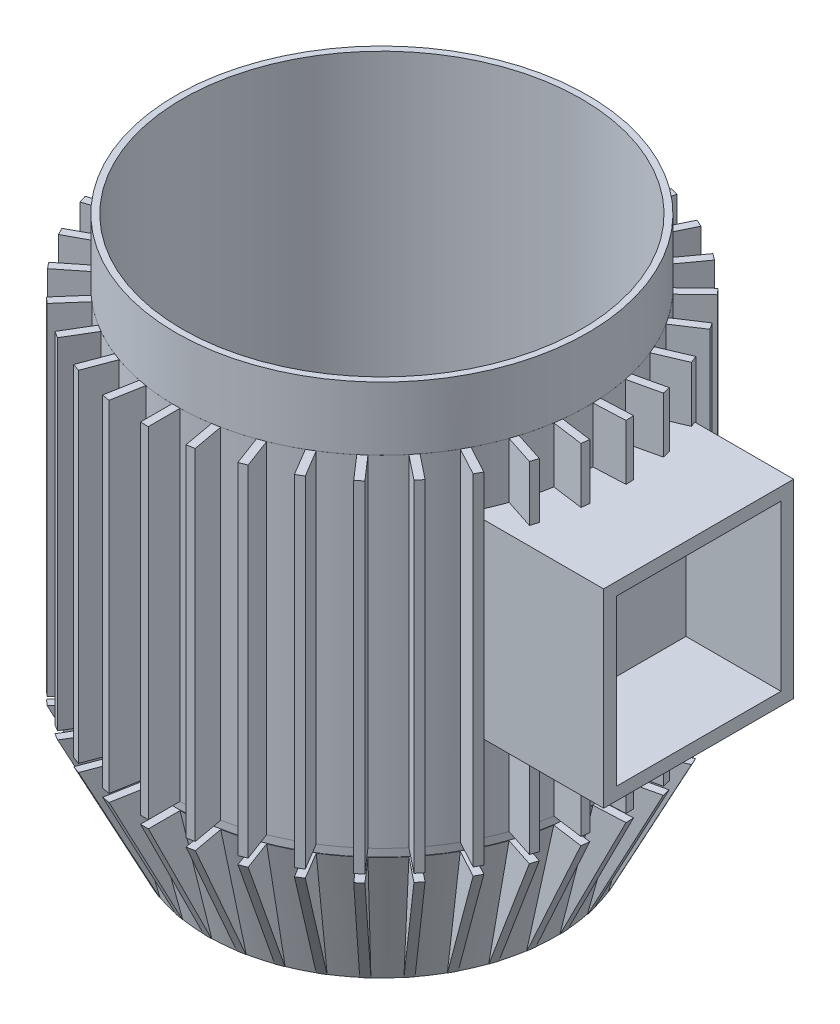
from build123d import *

# Parameters (mm, degrees)
SKETCH1_R           = 1651
BOSS_EXTRUDE1_DEPTH = 4318
CHAMFER1_SIZE       = 254
CHAMFER1_SIZE2      = 1016
SHELL1_T            = -50.8
BOSS_EXTRUDE2_REACH = 5834.329
SKETCH2_W           = 63.5
SKETCH2_H           = 4318
CIRPATTERN1_COUNT   = 35
SKETCH4_R           = 254
CUT_EXTRUDE1_DEPTH  = 5090.331297603
BOSS_EXTRUDE3_REACH = 6484.884
SKETCH6_W           = 1524
SKETCH6_H           = 1524
SKETCH7_W           = 1320.8
SKETCH7_H           = 1320.8
CUT_EXTRUDE3_DEPTH  = 762
SKETCH8_W           = 493.645068523
SKETCH8_H           = 508
SCALE1_SCALE        = 0.02


with BuildPart() as part:
    # Sketch1 → Boss-Extrude1 (new body)
    with BuildSketch(Plane(origin=(0, 0, 0), x_dir=(1, 0, 0), z_dir=(0, 1, 0))):
        Circle(SKETCH1_R)
    extrude(amount=-BOSS_EXTRUDE1_DEPTH)

    # Chamfer1
    chamfer1_edges = [part.edges().sort_by_distance(p)[0] for p in [
        (-1651, -4318, 0),
    ]]
    chamfer1_side = [part.faces().sort_by_distance(p)[0] for p in [
        (0, -4318, 0),
    ]]
    chamfer(chamfer1_edges, length=CHAMFER1_SIZE, length2=CHAMFER1_SIZE2, reference=chamfer1_side[0])

    # Shell1
    shell1_openings = [part.faces().sort_by_distance(p)[0] for p in [
        (0, 0, 0),
    ]]
    offset(amount=SHELL1_T, openings=shell1_openings, kind=Kind.INTERSECTION)

    # Sketch2 → Boss-Extrude2 (add, up to next)
    with BuildSketch(Plane.XY.offset(1905), mode=Mode.PRIVATE) as boss_extrude2_sk1:
        with Locations((0, -2159)):
            Rectangle(SKETCH2_W, SKETCH2_H)
    boss_extrude2_tool1 = extrude(boss_extrude2_sk1.sketch, amount=-BOSS_EXTRUDE2_REACH, mode=Mode.PRIVATE) - part.part
    boss_extrude2 = boss_extrude2_tool1.solids().sort_by_distance((0, -2159, 1905))[0]
    add(boss_extrude2)

    # CirPattern1: Boss-Extrude2 ×35 about axis
    cirpattern1_axis = Axis((0, -4318, 0), (0, 1, 0))
    for i in range(1, CIRPATTERN1_COUNT):
        add(boss_extrude2.rotate(cirpattern1_axis, i * 360 / CIRPATTERN1_COUNT))

    # Sketch3 → Cut-Revolve1 (revolve, cut)
    with BuildSketch(Plane.XY):
        Polygon((-1398.865454697, -4318), (-1904.506250125, -3302), (-1647.608085237, -3302), (-1647.608085237, -3238.5), (-2052.186441023, -3238.5), (-2052.186441023, -4573.4164032), align=None)
    revolve(axis=Axis((0, 0, 0), (0, -1, 0)), mode=Mode.SUBTRACT)

    # Sketch4 → Cut-Extrude1 (cut, through all)
    with BuildSketch(Plane.XZ.offset(4318)):
        Circle(SKETCH4_R)
    extrude(amount=-CUT_EXTRUDE1_DEPTH, mode=Mode.SUBTRACT)

    # Sketch6 → Boss-Extrude3 (add, up to next)
    with BuildSketch(Plane(origin=(2540, 0, 0), x_dir=(0, 0, -1), z_dir=(1, 0, 0)), mode=Mode.PRIVATE) as boss_extrude3_sk1:
        with Locations((0, -1714.5)):
            Rectangle(SKETCH6_W, SKETCH6_H)
    boss_extrude3_tool1 = extrude(boss_extrude3_sk1.sketch, amount=-BOSS_EXTRUDE3_REACH, mode=Mode.PRIVATE) - part.part
    add(boss_extrude3_tool1.solids().sort_by_distance((2540, -1714.5, 0))[0])

    # Sketch7 → Cut-Extrude3 (cut)
    with BuildSketch(Plane(origin=(2540, 0, 0), x_dir=(0, 0, -1), z_dir=(1, 0, 0))):
        with Locations((0, -1714.5)):
            Rectangle(SKETCH7_W, SKETCH7_H)
    extrude(amount=-CUT_EXTRUDE3_DEPTH, mode=Mode.SUBTRACT)

    # Sketch8 → Cut-Revolve2 (revolve, cut)
    with BuildSketch(Plane(origin=(0, 0, 0), x_dir=(0, 0, -1), z_dir=(1, 0, 0))):
        with Locations((-1897.51721757, -254)):
            Rectangle(SKETCH8_W, SKETCH8_H)
    revolve(axis=Axis((0, 0, 0), (0, -1, 0)), mode=Mode.SUBTRACT)


with BuildPart() as part_1:
    # Scale1: scaled about (286.010032781, -2200.142581701, 3.975067399)
    add(part.part.scale(SCALE1_SCALE).moved(Location((280.289832125, -2156.139730067, 3.895566051))))


solid = part_1.part
